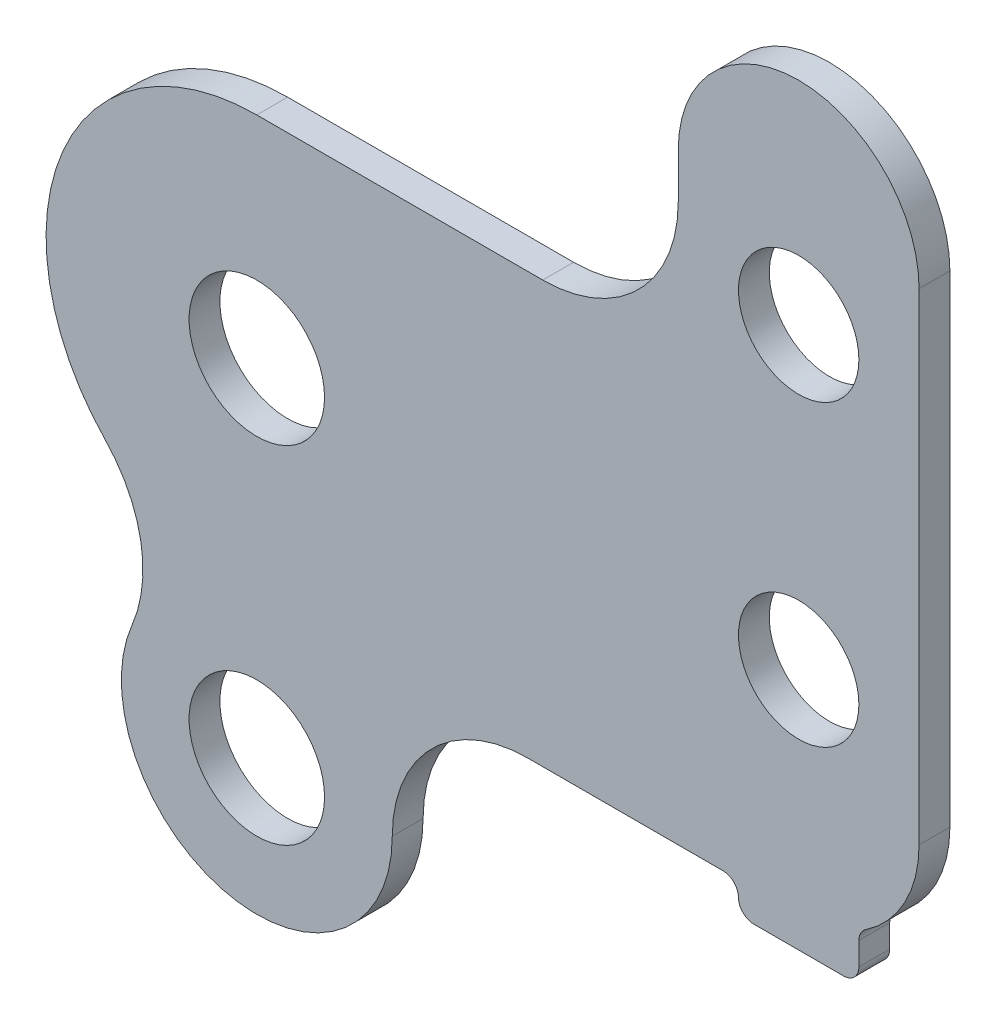
from build123d import *

# Parameters (mm, degrees)
SKETCH1_R           = 1.5875
SKETCH1_R_2         = 1.7859375
BOSS_EXTRUDE1_DEPTH = 0.8128
FILLET1_R           = 0.4064
FILLET2_R           = 3.571875


with BuildPart() as part:
    # Sketch1 → Boss-Extrude1 (new body)
    with BuildSketch(Plane.XY):
        with BuildLine():
            ThreePointArc((17.462464722, 10.31875), (14.287464722, 13.49375), (11.112464722, 10.31875))
            Line((11.112464722, 10.31875), (11.112464722, 5.55625))
            Line((11.112464722, 5.55625), (0, 5.55625))
            ThreePointArc((0, 5.55625), (-5.113201992, 2.17418478), (-4.001636336, -3.854714088))
            ThreePointArc((-4.001636336, -3.854714088), (-3.061446663, -5.6851033), (-3.287058398, -7.730434724))
            ThreePointArc((-3.287058398, -7.730434724), (-0.713207299, -12.628071623), (3.571875, -9.128125))
            ThreePointArc((3.571875, -9.128125), (4.61805296, -6.602427972), (7.143749984, -5.55625))
            Line((7.143749984, -5.55625), (12.699964722, -5.55625))
            Line((12.699964722, -5.55625), (12.699964722, -6.36905))
            Line((12.699964722, -6.36905), (15.874964722, -6.36905))
            Line((15.874964722, -6.36905), (15.874964722, -5.130880657))
            ThreePointArc((15.874964722, -5.130880657), (17.037095379, -3.96875), (17.462464722, -2.38125))
            Line((17.462464722, -2.38125), (17.462464722, 10.31875))
        make_face()
        with Locations((14.287464722, 0.03175)):
            Circle(SKETCH1_R, mode=Mode.SUBTRACT)
        with Locations((14.287464722, 7.90575)):
            Circle(SKETCH1_R, mode=Mode.SUBTRACT)
        Circle(SKETCH1_R_2, mode=Mode.SUBTRACT)
        with Locations((0, -9.128125)):
            Circle(SKETCH1_R_2, mode=Mode.SUBTRACT)
    extrude(amount=BOSS_EXTRUDE1_DEPTH)

    # Fillet1
    fillet1_edges = [part.edges().sort_by_distance(p)[0] for p in [
        (15.874964722, -5.130880657, 0.4064),
        (15.874964722, -6.36905, 0.4064),
        (12.699964722, -5.55625, 0.4064),
        (12.699964722, -6.36905, 0.4064),
    ]]
    fillet(fillet1_edges, radius=FILLET1_R - 0.0001)  # a hair under: the kernel refuses the full size

    # Fillet2
    fillet2_edges = [part.edges().sort_by_distance(p)[0] for p in [
        (11.112464722, 5.55625, 0.4064),
    ]]
    fillet(fillet2_edges, radius=FILLET2_R)


solid = part.part
